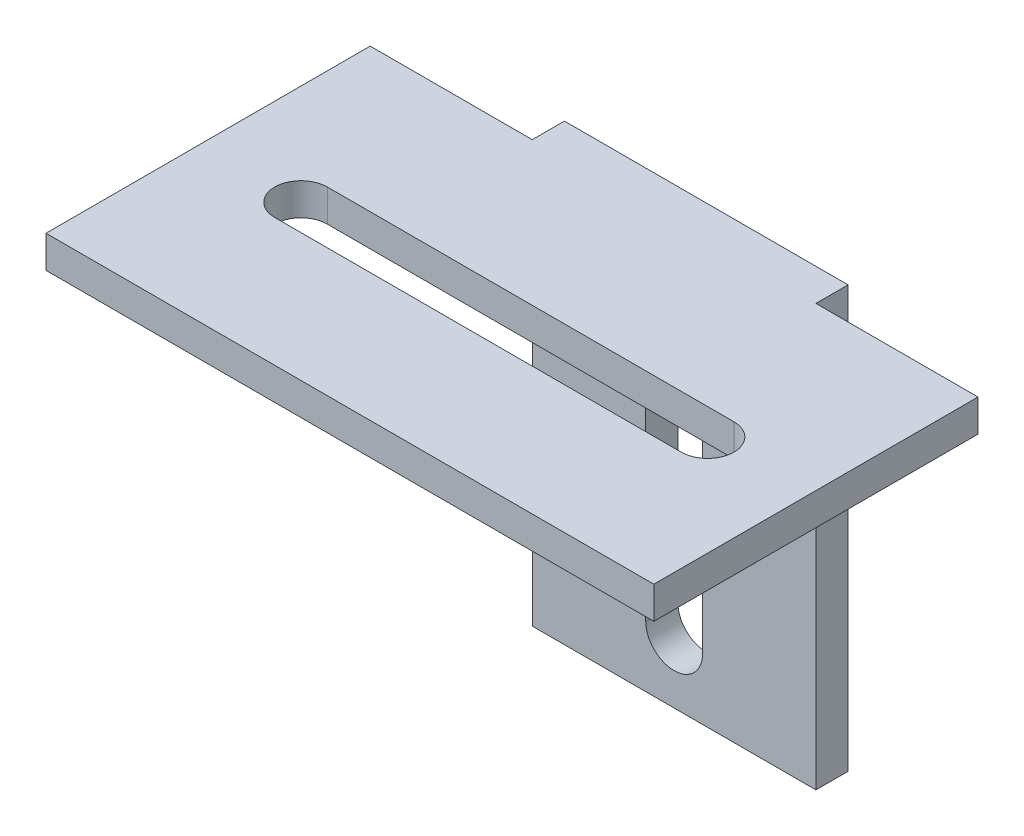
from build123d import *

# Parameters (mm, degrees)
CROQUIS1_R                 = 6.35
CROQUIS1_R_2               = 6.26
CROQUIS1_R_3               = 6.25
SALIENTE_EXTRUIR1_DEPTH    = 7.9375
CROQUIS2_W                 = 150
CROQUIS2_H                 = 104.1375
SALIENTE_EXTRUIR2_DEPTH    = 7.9375
CONVERTIR_S_LIDO4_START    = -75
CONVERTIR_S_LIDO4_DEPTH    = 150
CONVERTIR_S_LIDO4_2_DEPTH  = 150
CORTAR_EXTRUIR4_DEPTH      = 369.571050011
CORTAR_EXTRUIR4_DEPTH_BACK = 369.571050011
CROQUIS4_W                 = 150
CROQUIS4_H                 = 11.2
CROQUIS7_W                 = 70
CROQUIS7_H                 = 96.03125
CROQUIS7_H_2               = 7.9375
SALIENTE_EXTRUIR3_DEPTH    = 7.9375


# Read off the part's stored shape, not the designer's step: Convertir-Sólido4
with BuildPart() as part:
    # Croquis1 → Saliente-Extruir1 (new body)
    with BuildSketch(Plane.XY):
        with BuildLine():
            Line((-75, 16), (-75, 0))
            Line((-75, 0), (75, 0))
            Line((75, 0), (75, 54))
            ThreePointArc((75, 54), (60.355339059, 89.355339059), (25, 104))
            Line((25, 104), (-200, 104))
            ThreePointArc((-200, 104), (-235.355339059, 89.355339059), (-250, 54))
            Line((-250, 54), (-250, 0))
            ThreePointArc((-250, 0), (0, -250), (250, 0))
            ThreePointArc((250, 0), (200, 50), (150, 0))
            ThreePointArc((150, 0), (0, -150), (-150, 0))
            Line((-150, 0), (-150, 16))
            Line((-150, 16), (-75, 16))
        make_face()
        with BuildLine():
            ThreePointArc((-49.374105038, 47.65), (-55.724105038, 54), (-49.374105038, 60.35))
            Line((-49.374105038, 60.35), (49.374105038, 60.35))
            ThreePointArc((49.374105038, 60.35), (55.724105038, 54), (49.374105038, 47.65))
            Line((49.374105038, 47.65), (-49.374105038, 47.65))
        make_face(mode=Mode.SUBTRACT)
        with Locations((193.418858597, -50.883643138)):
            Circle(CROQUIS1_R, mode=Mode.SUBTRACT)
        with Locations((200, 0)):
            Circle(CROQUIS1_R_2, mode=Mode.SUBTRACT)
        with Locations((-100, -173.205080757)):
            Circle(CROQUIS1_R_3, mode=Mode.SUBTRACT)
        with Locations((-50.883643138, -193.418858597)):
            Circle(CROQUIS1_R, mode=Mode.SUBTRACT)
        with Locations((-140.775956893, -142.063823547)):
            Circle(CROQUIS1_R, mode=Mode.SUBTRACT)
        with Locations((-173.205080757, -100)):
            Circle(CROQUIS1_R, mode=Mode.SUBTRACT)
        with Locations((0, -200)):
            Circle(CROQUIS1_R_3, mode=Mode.SUBTRACT)
        with Locations((52.642901704, -192.947466685)):
            Circle(CROQUIS1_R, mode=Mode.SUBTRACT)
        with Locations((100, -173.205080757)):
            Circle(CROQUIS1_R_3, mode=Mode.SUBTRACT)
        with Locations((142.063823547, -140.775956893)):
            Circle(CROQUIS1_R, mode=Mode.SUBTRACT)
        with Locations((173.205080757, -100)):
            Circle(CROQUIS1_R_3, mode=Mode.SUBTRACT)
        with Locations((-192.947466685, -52.642901704)):
            Circle(CROQUIS1_R, mode=Mode.SUBTRACT)
        with Locations((-200, 0)):
            Circle(CROQUIS1_R, mode=Mode.SUBTRACT)
        with Locations((-200, 54)):
            Circle(CROQUIS1_R, mode=Mode.SUBTRACT)
    extrude(amount=SALIENTE_EXTRUIR1_DEPTH)

    # Croquis2 → Saliente-Extruir2 (add)
    with BuildSketch(Plane.XZ):
        with Locations((0, 52.06875)):
            Rectangle(CROQUIS2_W, CROQUIS2_H)
        with BuildLine():
            Line((-50.16849794, 72.5375), (50.16849794, 72.5375))
            ThreePointArc((50.16849794, 72.5375), (56.66849794, 66.0375), (50.16849794, 59.5375))
            Line((50.16849794, 59.5375), (-50.16849794, 59.5375))
            ThreePointArc((-50.16849794, 59.5375), (-56.66849794, 66.0375), (-50.16849794, 72.5375))
        make_face(mode=Mode.SUBTRACT)
    extrude(amount=-SALIENTE_EXTRUIR2_DEPTH)

    # Convertir-Sólido4 outline → Convertir-Sólido4 (cut)
    with BuildSketch(Plane.YZ.offset(CONVERTIR_S_LIDO4_START)):
        with BuildLine():
            Line((0, 12.9375), (0, 0))
            Line((0, 0), (12.9375, 0))
            ThreePointArc((12.9375, 0), (3.789306018, 3.789306018), (0, 12.9375))
        make_face()
    extrude(amount=CONVERTIR_S_LIDO4_DEPTH, mode=Mode.SUBTRACT)

    # Convertir-S_lido4 2 outline → Convertir-S_lido4 2 (add)
    with BuildSketch(Plane.YZ.offset(CONVERTIR_S_LIDO4_START)):
        with BuildLine():
            Line((7.9375, 12.9375), (7.9375, 7.9375))
            Line((7.9375, 7.9375), (12.9375, 7.9375))
            ThreePointArc((12.9375, 7.9375), (9.401966094, 9.401966094), (7.9375, 12.9375))
        make_face()
    extrude(amount=CONVERTIR_S_LIDO4_2_DEPTH)

    # Croquis4 → Cortar-Extruir4 (cut, two sides: drawn at the far end of the back side and taken through both)
    with BuildSketch(Plane.XZ.offset(-CORTAR_EXTRUIR4_DEPTH_BACK)):
        Polygon((-75, 12.9375), (-75, 24.1375), (-279.933014074, 24.1375), (-279.933014074, -40.537488795), (278.241575923, -40.537488795), (278.241575923, 24.1375), (75, 24.1375), (75, 12.9375), align=None)
        with Locations((0, 18.5375)):
            Rectangle(CROQUIS4_W, CROQUIS4_H)
    extrude(amount=CORTAR_EXTRUIR4_DEPTH + CORTAR_EXTRUIR4_DEPTH_BACK, mode=Mode.SUBTRACT)

    # Croquis7 → Saliente-Extruir3 (add)
    # profile 1 of 2: a face of its own
    with BuildSketch(Plane(origin=(0, 0, 24.1375), x_dir=(-1, 0, 0), z_dir=(0, 0, -1))):
        with Locations((0, -48.015625)):
            Rectangle(CROQUIS7_W, CROQUIS7_H)
        with BuildLine():
            ThreePointArc((-7, -13.240738452), (0, -6.240738452), (7, -13.240738452))
            Line((7, -13.240738452), (7, -81.03125))
            ThreePointArc((7, -81.03125), (0, -88.03125), (-7, -81.03125))
            Line((-7, -81.03125), (-7, -13.240738452))
        make_face(mode=Mode.SUBTRACT)
    # profile 2 of 2: a face of its own
    with BuildSketch(Plane(origin=(0, 0, 24.1375), x_dir=(-1, 0, 0), z_dir=(0, 0, -1))):
        with Locations((0, 3.96875)):
            Rectangle(CROQUIS7_W, CROQUIS7_H_2)
    extrude(amount=SALIENTE_EXTRUIR3_DEPTH)


solid = part.part
